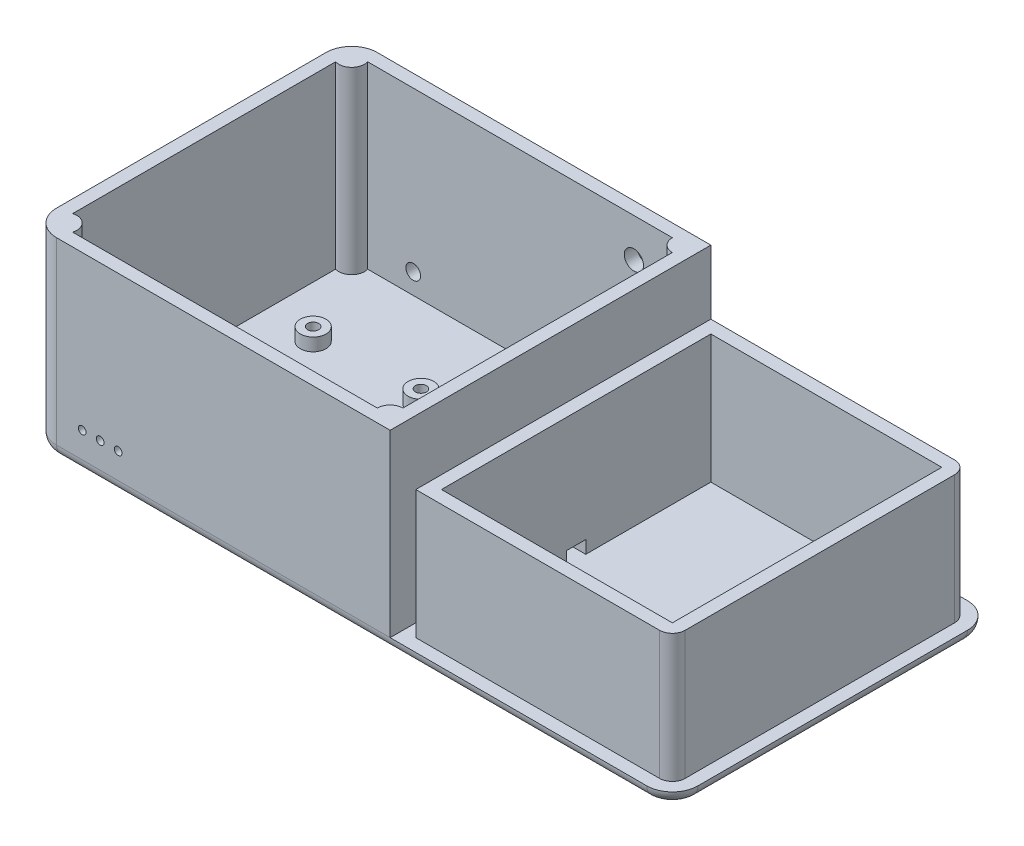
from build123d import *

# Parameters (mm, degrees)
BOSS_EXTRUDE1_DEPTH = 5
FILLET1_R           = 5
SKETCH2_W           = 5
SKETCH2_H           = 115
SKETCH2_H_2         = 5
BOSS_EXTRUDE2_DEPTH = 70
SKETCH2_3_W         = 5
SKETCH2_3_H         = 105
SKETCH2_3_H_2       = 5
BOSS_EXTRUDE3_DEPTH = 50
SKETCH3_R           = 5
BOSS_EXTRUDE4_DEPTH = 70
CUT_EXTRUDE1_REACH  = 168.602
SKETCH4_W           = 7.5
SKETCH4_H           = 5
SKETCH5_R           = 2.875
SKETCH5_R_2         = 3.75
CUT_EXTRUDE2_DEPTH  = 5
SKETCH6_R           = 1.5
CUT_EXTRUDE3_DEPTH  = 5
SKETCH8_R           = 5
SKETCH8_R_2         = 2.15
BOSS_EXTRUDE5_DEPTH = 5


with BuildPart() as part:
    # Sketch1 → Boss-Extrude1 (new body)
    with BuildSketch(Plane(origin=(0, 0, 0), x_dir=(1, 0, 0), z_dir=(0, 1, 0))):
        with BuildLine():
            Line((-115, -62.5), (115, -62.5))
            ThreePointArc((115, -62.5), (122.071067812, -59.571067812), (125, -52.5))
            Line((125, -52.5), (125, 52.5))
            ThreePointArc((125, 52.5), (122.071067812, 59.571067812), (115, 62.5))
            Line((115, 62.5), (-115, 62.5))
            ThreePointArc((-115, 62.5), (-122.071067812, 59.571067812), (-125, 52.5))
            Line((-125, 52.5), (-125, -52.5))
            ThreePointArc((-125, -52.5), (-122.071067812, -59.571067812), (-115, -62.5))
        make_face()
    extrude(amount=BOSS_EXTRUDE1_DEPTH)

    # Fillet1
    fillet1_edges = [part.edges().sort_by_distance(p)[0] for p in [
        (0, 0, 62.5),
        (122.071067812, 0, 59.571067812),
        (125, 0, 0),
        (122.071067812, 0, -59.571067812),
        (0, 0, -62.5),
        (-122.071067812, 0, -59.571067812),
        (-125, 0, 0),
        (-122.071067812, 0, 59.571067812),
    ]]
    fillet(fillet1_edges, radius=FILLET1_R - 0.0001)  # a hair under: the kernel refuses the full size

    # Sketch2 → Boss-Extrude2 (add)
    with BuildSketch(Plane(origin=(0, 5, 0), x_dir=(1, 0, 0), z_dir=(0, 1, 0))):
        with Locations((12.5, 0)):
            Rectangle(SKETCH2_W, SKETCH2_H)
        with Locations((12.5, -60)):
            Rectangle(SKETCH2_W, SKETCH2_H_2)
        with BuildLine():
            Line((10, -62.5), (10, -57.5))
            Line((10, -57.5), (-115, -57.5))
            ThreePointArc((-115, -57.5), (-118.535533906, -56.035533906), (-120, -52.5))
            Line((-120, -52.5), (-120, 52.5))
            ThreePointArc((-120, 52.5), (-118.535533906, 56.035533906), (-115, 57.5))
            Line((-115, 57.5), (10, 57.5))
            Line((10, 57.5), (10, 62.5))
            Line((10, 62.5), (-115, 62.5))
            ThreePointArc((-115, 62.5), (-122.071067812, 59.571067812), (-125, 52.5))
            Line((-125, 52.5), (-125, -52.5))
            ThreePointArc((-125, -52.5), (-122.071067812, -59.571067812), (-115, -62.5))
            Line((-115, -62.5), (10, -62.5))
        make_face()
        with Locations((12.5, 60)):
            Rectangle(SKETCH2_W, SKETCH2_H_2)
    extrude(amount=BOSS_EXTRUDE2_DEPTH)

    # Sketch2<3> → Boss-Extrude3 (add)
    with BuildSketch(Plane(origin=(0, 5, 0), x_dir=(1, 0, 0), z_dir=(0, 1, 0))):
        with Locations((22.5, 0)):
            Rectangle(SKETCH2_3_W, SKETCH2_3_H)
        with BuildLine():
            Line((25, -52.5), (25, -57.5))
            Line((25, -57.5), (115, -57.5))
            ThreePointArc((115, -57.5), (118.535533906, -56.035533906), (120, -52.5))
            Line((120, -52.5), (120, 52.5))
            ThreePointArc((120, 52.5), (118.535533906, 56.035533906), (115, 57.5))
            Line((115, 57.5), (25, 57.5))
            Line((25, 57.5), (25, 52.5))
            Line((25, 52.5), (115, 52.5))
            Line((115, 52.5), (115, -52.5))
            Line((115, -52.5), (25, -52.5))
        make_face()
        with Locations((22.5, 55)):
            Rectangle(SKETCH2_3_W, SKETCH2_3_H_2)
        with Locations((22.5, -55)):
            Rectangle(SKETCH2_3_W, SKETCH2_3_H_2)
    extrude(amount=BOSS_EXTRUDE3_DEPTH)

    # Sketch3 → Boss-Extrude4 (add)
    with BuildSketch(Plane(origin=(0, 75, 0), x_dir=(1, 0, 0), z_dir=(0, 1, 0))):
        with Locations((-118.535533906, 56.035533906)):
            Circle(SKETCH3_R)
        with Locations((10, 57.5)):
            Circle(SKETCH3_R)
        with Locations((10, -57.5)):
            Circle(SKETCH3_R)
        with Locations((-118.535533906, -56.035533906)):
            Circle(SKETCH3_R)
    extrude(amount=-BOSS_EXTRUDE4_DEPTH)

    # Cut-Extrude1: up to this face of the body (flat: up to its plane)
    cut_extrude1_end = Plane(part.part.faces().sort_by_distance((25, 30, 0))[0])
    # Sketch4 → Cut-Extrude1 (cut, up to the picked face)
    with BuildSketch(Plane.ZY.offset(-10), mode=Mode.PRIVATE) as cut_extrude1_sk1:
        with Locations((0, 7.5)):
            Rectangle(SKETCH4_W, SKETCH4_H)
    cut_extrude1_tool1 = split(extrude(cut_extrude1_sk1.sketch, amount=-CUT_EXTRUDE1_REACH, mode=Mode.PRIVATE), bisect_by=cut_extrude1_end, keep=Keep.BOTH, mode=Mode.PRIVATE)
    add(cut_extrude1_tool1.solids().sort_by(Axis((10, 7.5, 0), (1, 0, 0)))[0], mode=Mode.SUBTRACT)

    # Sketch5 → Cut-Extrude2 (cut)
    with BuildSketch(Plane.XY.offset(-57.5)):
        with Locations((-96, 13)):
            Circle(SKETCH5_R)
        with Locations((-10, 60)):
            Circle(SKETCH5_R_2)
    extrude(amount=-CUT_EXTRUDE2_DEPTH, mode=Mode.SUBTRACT)

    # Sketch6 → Cut-Extrude3 (cut)
    with BuildSketch(Plane.XY.offset(62.5)):
        with Locations((-105, 15)):
            Circle(SKETCH6_R)
        with Locations((-98, 15)):
            Circle(SKETCH6_R)
        with Locations((-91, 15)):
            Circle(SKETCH6_R)
    extrude(amount=-CUT_EXTRUDE3_DEPTH, mode=Mode.SUBTRACT)

    # Sketch8 → Boss-Extrude5 (add)
    # profile 1 of 4: a face of its own
    with BuildSketch(Plane(origin=(0, 5, 0), x_dir=(1, 0, 0), z_dir=(0, 1, 0))):
        with Locations(Location((-100, -37.5, 0), (0, 0, 90))):
            Circle(SKETCH8_R)
        with Locations(Location((-100, -37.5, 0), (0, 0, 270))):
            Circle(SKETCH8_R_2, mode=Mode.SUBTRACT)
    # profile 2 of 4: a face of its own
    with BuildSketch(Plane(origin=(0, 5, 0), x_dir=(1, 0, 0), z_dir=(0, 1, 0))):
        with Locations(Location((-58, -37.5, 0), (0, 0, 90))):
            Circle(SKETCH8_R)
        with Locations(Location((-58, -37.5, 0), (0, 0, 270))):
            Circle(SKETCH8_R_2, mode=Mode.SUBTRACT)
    # profile 3 of 4: a face of its own
    with BuildSketch(Plane(origin=(0, 5, 0), x_dir=(1, 0, 0), z_dir=(0, 1, 0))):
        with Locations(Location((-58, 22.5, 0), (0, 0, 90))):
            Circle(SKETCH8_R)
        with Locations(Location((-58, 22.5, 0), (0, 0, 270))):
            Circle(SKETCH8_R_2, mode=Mode.SUBTRACT)
    # profile 4 of 4: a face of its own
    with BuildSketch(Plane(origin=(0, 5, 0), x_dir=(1, 0, 0), z_dir=(0, 1, 0))):
        with Locations(Location((-100, 22.5, 0), (0, 0, 90))):
            Circle(SKETCH8_R)
        with Locations(Location((-100, 22.5, 0), (0, 0, 270))):
            Circle(SKETCH8_R_2, mode=Mode.SUBTRACT)
    extrude(amount=BOSS_EXTRUDE5_DEPTH)


solid = part.part
